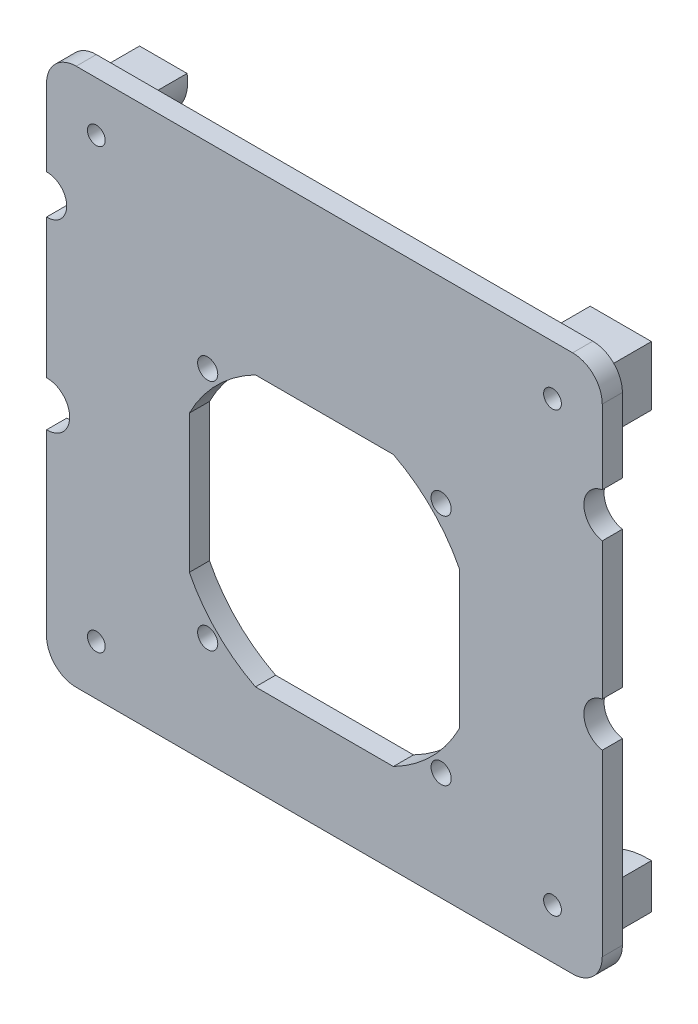
from build123d import *

# Parameters (mm, degrees)
SKETCH1_R                 = 2.54
SKETCH1_R_2               = 1.905
BOSS_EXTRUDE1_DEPTH       = 10.922
BOSS_EXTRUDE1_2_DEPTH     = 10.922
BOSS_EXTRUDE1_3_DEPTH     = 10.922
BOSS_EXTRUDE1_4_DEPTH     = 10.922
BOSS_EXTRUDE3_START       = -10.922
BOSS_EXTRUDE3_OUTLINE_R   = 1.905
BOSS_EXTRUDE3_DEPTH       = 10.922
BOSS_EXTRUDE3_2_OUTLINE_R = 1.905
BOSS_EXTRUDE3_2_DEPTH     = 10.922
BOSS_EXTRUDE3_3_OUTLINE_R = 1.905
BOSS_EXTRUDE3_3_DEPTH     = 10.922
BOSS_EXTRUDE3_4_OUTLINE_R = 1.905
BOSS_EXTRUDE3_4_DEPTH     = 10.922
BOSS_EXTRUDE4_START       = 4.318
SKETCH3_R                 = 1.905
BOSS_EXTRUDE4_DEPTH       = 4.318
FILLET1_R                 = 6.35
CUT_EXTRUDE1_REACH        = 176.845
SKETCH5_R                 = 2.159


with BuildPart() as part:
    # Sketch1 → Boss-Extrude1 (new body)
    with BuildSketch(Plane.XY):
        with Locations((83.701311305, -41.752062977)):
            Circle(SKETCH1_R)
        with Locations((83.701311305, -41.752062977)):
            Circle(SKETCH1_R_2, mode=Mode.SUBTRACT)
    extrude(amount=-BOSS_EXTRUDE1_DEPTH)

    # Boss-Extrude3: read off the stored shape, not the designer's step
    # Boss-Extrude3 outline → Boss-Extrude3 (add)
    with BuildSketch(Plane.XY.offset(BOSS_EXTRUDE3_START)):
        with BuildLine():
            Line((89.670311305, -35.783062977), (76.540111305, -35.783062977))
            ThreePointArc((76.540111305, -35.783062977), (81.82257698, -43.469198406), (89.670311305, -48.508462977))
            Line((89.670311305, -48.508462977), (89.670311305, -35.783062977))
        make_face()
        with Locations((83.701311305, -41.752062977)):
            Circle(BOSS_EXTRUDE3_OUTLINE_R, mode=Mode.SUBTRACT)
    extrude(amount=BOSS_EXTRUDE3_DEPTH)



with BuildPart() as body_2:
    # Sketch1 → Boss-Extrude1 2 (new body)
    with BuildSketch(Plane.XY):
        with Locations((-14.088688695, -41.752062977)):
            Circle(SKETCH1_R)
        with Locations((-14.088688695, -41.752062977)):
            Circle(SKETCH1_R_2, mode=Mode.SUBTRACT)
    extrude(amount=-BOSS_EXTRUDE1_2_DEPTH)

    # Boss-Extrude3 4 outline → Boss-Extrude3 4 (add)
    with BuildSketch(Plane.XY.offset(BOSS_EXTRUDE3_START)):
        with BuildLine():
            Line((-20.057688695, -35.783062977), (-20.057688695, -46.006562977))
            ThreePointArc((-20.057688695, -46.006562977), (-12.297393991, -43.552911895), (-9.874167768, -35.783062977))
            Line((-9.874167768, -35.783062977), (-20.057688695, -35.783062977))
        make_face()
        with Locations((-14.088688695, -41.752062977)):
            Circle(BOSS_EXTRUDE3_4_OUTLINE_R, mode=Mode.SUBTRACT)
    extrude(amount=BOSS_EXTRUDE3_4_DEPTH)


with BuildPart() as body_3:
    # Sketch1 → Boss-Extrude1 3 (new body)
    with BuildSketch(Plane.XY):
        with Locations((-14.088688695, -135.732062977)):
            Circle(SKETCH1_R)
        with Locations((-14.088688695, -135.732062977)):
            Circle(SKETCH1_R_2, mode=Mode.SUBTRACT)
    extrude(amount=-BOSS_EXTRUDE1_3_DEPTH)

    # Boss-Extrude3 3 outline → Boss-Extrude3 3 (add)
    with BuildSketch(Plane.XY.offset(BOSS_EXTRUDE3_START)):
        with BuildLine():
            Line((-20.057688695, -141.701062977), (-6.875088695, -141.701062977))
            ThreePointArc((-6.875088695, -141.701062977), (-12.276682873, -133.951830584), (-20.057688695, -128.59610741))
            Line((-20.057688695, -128.59610741), (-20.057688695, -141.701062977))
        make_face()
        with Locations((-14.088688695, -135.732062977)):
            Circle(BOSS_EXTRUDE3_3_OUTLINE_R, mode=Mode.SUBTRACT)
    extrude(amount=BOSS_EXTRUDE3_3_DEPTH)


with BuildPart() as body_4:
    # Sketch1 → Boss-Extrude1 4 (new body)
    with BuildSketch(Plane.XY):
        with Locations((83.701311305, -135.732062977)):
            Circle(SKETCH1_R)
        with Locations((83.701311305, -135.732062977)):
            Circle(SKETCH1_R_2, mode=Mode.SUBTRACT)
    extrude(amount=-BOSS_EXTRUDE1_4_DEPTH)

    # Boss-Extrude3 2 outline → Boss-Extrude3 2 (add)
    with BuildSketch(Plane.XY.offset(BOSS_EXTRUDE3_START)):
        with BuildLine():
            Line((89.670311305, -141.701062977), (89.670311305, -132.150662977))
            ThreePointArc((89.670311305, -132.150662977), (80.369588205, -134.573287653), (73.922311305, -141.701062977))
            Line((73.922311305, -141.701062977), (89.670311305, -141.701062977))
        make_face()
        with Locations((83.701311305, -135.732062977)):
            Circle(BOSS_EXTRUDE3_2_OUTLINE_R, mode=Mode.SUBTRACT)
    extrude(amount=BOSS_EXTRUDE3_2_DEPTH)


with BuildPart() as part_1:
    add(part.part)

    add(body_2.part)  # Boss-Extrude4 merges body 2

    add(body_3.part)  # Boss-Extrude4 merges body 3

    add(body_4.part)  # Boss-Extrude4 merges body 4
    # Sketch3 → Boss-Extrude4 (add)
    with BuildSketch(Plane.XY.offset(BOSS_EXTRUDE4_START)):
        with BuildLine():
            Line((-24.756688695, -101.757891635), (-24.756688695, -146.400062977))
            Line((-24.756688695, -146.400062977), (94.369311305, -146.400062977))
            Line((94.369311305, -146.400062977), (94.369311305, -101.676974724))
            ThreePointArc((94.369311305, -101.676974724), (90.432311305, -96.933562977), (94.369311305, -92.19015123))
            Line((94.369311305, -92.19015123), (94.369311305, -62.814974724))
            ThreePointArc((94.369311305, -62.814974724), (90.432311305, -58.071562977), (94.369311305, -53.32815123))
            Line((94.369311305, -53.32815123), (94.369311305, -31.084062977))
            Line((94.369311305, -31.084062977), (-24.756688695, -31.084062977))
            Line((-24.756688695, -31.084062977), (-24.756688695, -53.882487661))
            ThreePointArc((-24.756688695, -53.882487661), (-20.438688695, -58.071562977), (-24.756688695, -62.260638293))
            Line((-24.756688695, -62.260638293), (-24.756688695, -92.109234319))
            ThreePointArc((-24.756688695, -92.109234319), (-19.803688695, -96.933562977), (-24.756688695, -101.757891635))
        make_face()
        with Locations((83.701311305, -41.752062977)):
            Circle(SKETCH3_R, mode=Mode.SUBTRACT)
        with Locations((-14.088688695, -135.732062977)):
            Circle(SKETCH3_R, mode=Mode.SUBTRACT)
        with Locations((83.701311305, -135.732062977)):
            Circle(SKETCH3_R, mode=Mode.SUBTRACT)
        with Locations((-14.088688695, -41.752062977)):
            Circle(SKETCH3_R, mode=Mode.SUBTRACT)
    extrude(amount=-BOSS_EXTRUDE4_DEPTH)

    # Fillet1
    fillet1_edges = [part_1.edges().sort_by_distance(p)[0] for p in [
        (-24.756688695, -146.400062977, 2.159),
        (94.369311305, -146.400062977, 2.159),
        (94.369311305, -31.084062977, 2.159),
        (-24.756688695, -31.084062977, 2.159),
    ]]
    fillet(fillet1_edges, radius=FILLET1_R)

    # Sketch5 → Cut-Extrude1 (cut, up to next)
    with BuildSketch(Plane.XY.offset(4.318), mode=Mode.PRIVATE) as cut_extrude1_sk1:
        with BuildLine():
            Line((5.850311305, -98.140062977), (34.806311305, -98.140062977))
            Line((34.806311305, -98.140062977), (34.806311305, -69.184062977))
            Line((34.806311305, -69.184062977), (20.021852978, -69.184062977))
            ThreePointArc((20.021852978, -69.184062977), (11.816855635, -75.150607307), (5.850311305, -83.355604651))
            Line((5.850311305, -83.355604651), (5.850311305, -98.140062977))
        make_face()
    cut_extrude1_tool1 = extrude(cut_extrude1_sk1.sketch, amount=-CUT_EXTRUDE1_REACH, mode=Mode.PRIVATE) & part_1.part
    # Sketch5 → Cut-Extrude1 (cut, up to next)
    with BuildSketch(Plane.XY.offset(4.318), mode=Mode.PRIVATE) as cut_extrude1_sk2:
        with BuildLine():
            Line((34.806311305, -69.184062977), (34.806311305, -98.140062977))
            Line((34.806311305, -98.140062977), (63.762311305, -98.140062977))
            Line((63.762311305, -98.140062977), (63.762311305, -83.355604651))
            ThreePointArc((63.762311305, -83.355604651), (57.795766975, -75.150607307), (49.590769631, -69.184062977))
            Line((49.590769631, -69.184062977), (34.806311305, -69.184062977))
        make_face()
    cut_extrude1_tool2 = extrude(cut_extrude1_sk2.sketch, amount=-CUT_EXTRUDE1_REACH, mode=Mode.PRIVATE) & part_1.part
    # Sketch5 → Cut-Extrude1 (cut, up to next)
    with BuildSketch(Plane.XY.offset(4.318), mode=Mode.PRIVATE) as cut_extrude1_sk3:
        with Locations((9.787309036, -73.121060708)):
            Circle(SKETCH5_R)
    cut_extrude1_tool3 = extrude(cut_extrude1_sk3.sketch, amount=-CUT_EXTRUDE1_REACH, mode=Mode.PRIVATE) & part_1.part
    # Sketch5 → Cut-Extrude1 (cut, up to next)
    with BuildSketch(Plane.XY.offset(4.318), mode=Mode.PRIVATE) as cut_extrude1_sk4:
        with Locations((59.825309036, -73.121065246)):
            Circle(SKETCH5_R)
    cut_extrude1_tool4 = extrude(cut_extrude1_sk4.sketch, amount=-CUT_EXTRUDE1_REACH, mode=Mode.PRIVATE) & part_1.part
    # Sketch5 → Cut-Extrude1 (cut, up to next)
    with BuildSketch(Plane.XY.offset(4.318), mode=Mode.PRIVATE) as cut_extrude1_sk5:
        with Locations((59.825313573, -123.159065246)):
            Circle(SKETCH5_R)
    cut_extrude1_tool5 = extrude(cut_extrude1_sk5.sketch, amount=-CUT_EXTRUDE1_REACH, mode=Mode.PRIVATE) & part_1.part
    # Sketch5 → Cut-Extrude1 (cut, up to next)
    with BuildSketch(Plane.XY.offset(4.318), mode=Mode.PRIVATE) as cut_extrude1_sk6:
        with BuildLine():
            Line((34.806311305, -98.140062977), (34.806311305, -127.096062977))
            Line((34.806311305, -127.096062977), (49.590769631, -127.096062977))
            ThreePointArc((49.590769631, -127.096062977), (57.795766975, -121.129518647), (63.762311305, -112.924521303))
            Line((63.762311305, -112.924521303), (63.762311305, -98.140062977))
            Line((63.762311305, -98.140062977), (34.806311305, -98.140062977))
        make_face()
    cut_extrude1_tool6 = extrude(cut_extrude1_sk6.sketch, amount=-CUT_EXTRUDE1_REACH, mode=Mode.PRIVATE) & part_1.part
    # Sketch5 → Cut-Extrude1 (cut, up to next)
    with BuildSketch(Plane.XY.offset(4.318), mode=Mode.PRIVATE) as cut_extrude1_sk7:
        with BuildLine():
            Line((20.021852978, -127.096062977), (34.806311305, -127.096062977))
            Line((34.806311305, -127.096062977), (34.806311305, -98.140062977))
            Line((34.806311305, -98.140062977), (5.850311305, -98.140062977))
            Line((5.850311305, -98.140062977), (5.850311305, -112.924521303))
            ThreePointArc((5.850311305, -112.924521303), (11.816855635, -121.129518647), (20.021852978, -127.096062977))
        make_face()
    cut_extrude1_tool7 = extrude(cut_extrude1_sk7.sketch, amount=-CUT_EXTRUDE1_REACH, mode=Mode.PRIVATE) & part_1.part
    # Sketch5 → Cut-Extrude1 (cut, up to next)
    with BuildSketch(Plane.XY.offset(4.318), mode=Mode.PRIVATE) as cut_extrude1_sk8:
        with Locations((9.787313573, -123.159060708)):
            Circle(SKETCH5_R)
    cut_extrude1_tool8 = extrude(cut_extrude1_sk8.sketch, amount=-CUT_EXTRUDE1_REACH, mode=Mode.PRIVATE) & part_1.part
    add(cut_extrude1_tool1.solids().sort_by_distance((21.39883, -84.732582, 4.318))[0], mode=Mode.SUBTRACT)
    add(cut_extrude1_tool2.solids().sort_by_distance((48.213793, -84.732582, 4.318))[0], mode=Mode.SUBTRACT)
    add(cut_extrude1_tool3.solids().sort_by_distance((9.787309, -73.121061, 4.318))[0], mode=Mode.SUBTRACT)
    add(cut_extrude1_tool4.solids().sort_by_distance((59.825309, -73.121065, 4.318))[0], mode=Mode.SUBTRACT)
    add(cut_extrude1_tool5.solids().sort_by_distance((59.825314, -123.159065, 4.318))[0], mode=Mode.SUBTRACT)
    add(cut_extrude1_tool6.solids().sort_by_distance((48.213793, -111.547544, 4.318))[0], mode=Mode.SUBTRACT)
    add(cut_extrude1_tool7.solids().sort_by_distance((21.39883, -111.547544, 4.318))[0], mode=Mode.SUBTRACT)
    add(cut_extrude1_tool8.solids().sort_by_distance((9.787314, -123.159061, 4.318))[0], mode=Mode.SUBTRACT)


solid = part_1.part
